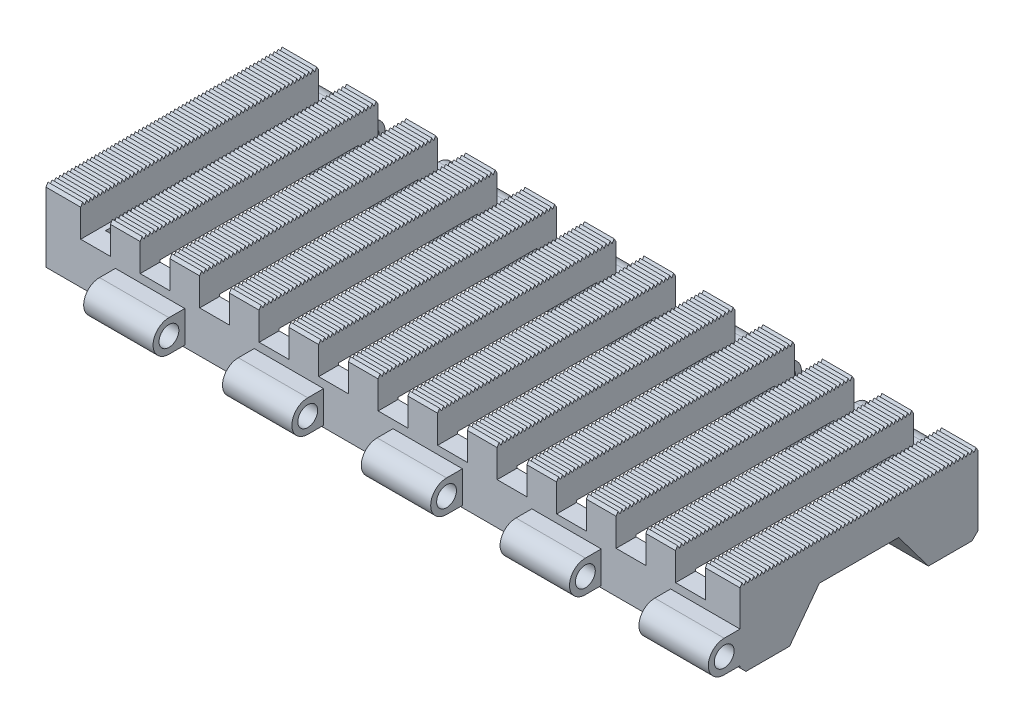
from build123d import *

# Parameters (mm, degrees)
BOSS_EXTRUDE1_DEPTH = 350
SKETCH1_3_OUTSIDE_W = 230.73
SKETCH1_3_OUTSIDE_H = 118.437
SKETCH1_3_OUTSIDE_R = 5
CUT_EXTRUDE2_DEPTH  = 350
SKETCH13_W          = 310
SKETCH13_H          = 100
CUT_EXTRUDE4_DEPTH  = 25
SKETCH13_4_W        = 35
SKETCH13_4_H        = 18.712598952
CUT_EXTRUDE12_DEPTH = 381.542793702
SKETCH15_W          = 15
SKETCH15_H          = 20
SKETCH15_H_2        = 19.813107859
SKETCH15_H_3        = 20.139700209
SKETCH15_H_4        = 23.911545417
SKETCH15_H_5        = 27.777556508
SKETCH15_H_6        = 25.56081457
SKETCH15_H_7        = 23.377606617
SKETCH15_H_8        = 22.603617706
SKETCH15_H_9        = 19.609158068
CUT_EXTRUDE18_DEPTH = 377.515335494


with BuildPart() as part:
    # Sketch1 → Boss-Extrude1 (new body)
    with BuildSketch(Plane(origin=(0, 0, 0), x_dir=(0, 0, -1), z_dir=(1, 0, 0))):
        with BuildLine():
            Line((68, 8), (48, 8))
            Line((48, 8), (33, -12))
            Line((33, -12), (11, -12))
            Line((11, -12), (8, -9))
            Line((8, -9), (8, -8.002466831))
            Line((8, -8.002466831), (0, -8.002466831))
            ThreePointArc((0, -8.002466831), (-8.002466831, 0), (0, 8.002466831))
            Line((0, 8.002466831), (8, 8.002466831))
            Line((8, 8.002466831), (8, 26.002466831))
            Line((8, 26.002466831), (9, 27.709165671))
            Line((9, 27.709165671), (10, 26.002466831))
            Line((10, 26.002466831), (11, 27.709165671))
            Line((11, 27.709165671), (12, 26.002466831))
            Line((12, 26.002466831), (13, 27.709165671))
            Line((13, 27.709165671), (14, 26.002466831))
            Line((14, 26.002466831), (15, 27.709165671))
            Line((15, 27.709165671), (16, 26.002466831))
            Line((16, 26.002466831), (17, 27.709165671))
            Line((17, 27.709165671), (18, 26.002466831))
            Line((18, 26.002466831), (19, 27.709165671))
            Line((19, 27.709165671), (20, 26.002466831))
            Line((20, 26.002466831), (21, 27.709165671))
            Line((21, 27.709165671), (22, 26.002466831))
            Line((22, 26.002466831), (23, 27.709165671))
            Line((23, 27.709165671), (24, 26.002466831))
            Line((24, 26.002466831), (25, 27.709165671))
            Line((25, 27.709165671), (26, 26.002466831))
            Line((26, 26.002466831), (27, 27.709165671))
            Line((27, 27.709165671), (28, 26.002466831))
            Line((28, 26.002466831), (29, 27.709165671))
            Line((29, 27.709165671), (30, 26.002466831))
            Line((30, 26.002466831), (31, 27.709165671))
            Line((31, 27.709165671), (32, 26.002466831))
            Line((32, 26.002466831), (33, 27.709165671))
            Line((33, 27.709165671), (34, 26.002466831))
            Line((34, 26.002466831), (35, 27.709165671))
            Line((35, 27.709165671), (36, 26.002466831))
            Line((36, 26.002466831), (37, 27.709165671))
            Line((37, 27.709165671), (38, 26.002466831))
            Line((38, 26.002466831), (39, 27.709165671))
            Line((39, 27.709165671), (40, 26.002466831))
            Line((40, 26.002466831), (41, 27.709165671))
            Line((41, 27.709165671), (42, 26.002466831))
            Line((42, 26.002466831), (43, 27.709165671))
            Line((43, 27.709165671), (44, 26.002466831))
            Line((44, 26.002466831), (45, 27.709165671))
            Line((45, 27.709165671), (46, 26.002466831))
            Line((46, 26.002466831), (47, 27.709165671))
            Line((47, 27.709165671), (48, 26.002466831))
            Line((48, 26.002466831), (49, 27.709165671))
            Line((49, 27.709165671), (50, 26.002466831))
            Line((50, 26.002466831), (51, 27.709165671))
            Line((51, 27.709165671), (52, 26.002466831))
            Line((52, 26.002466831), (53, 27.709165671))
            Line((53, 27.709165671), (54, 26.002466831))
            Line((54, 26.002466831), (55, 27.709165671))
            Line((55, 27.709165671), (56, 26.002466831))
            Line((56, 26.002466831), (57, 27.709165671))
            Line((57, 27.709165671), (58, 26.002466831))
            Line((58, 26.002466831), (59, 27.709165671))
            Line((59, 27.709165671), (60, 26.002466831))
            Line((60, 26.002466831), (61, 27.709165671))
            Line((61, 27.709165671), (62, 26.002466831))
            Line((62, 26.002466831), (63, 27.709165671))
            Line((63, 27.709165671), (64, 26.002466831))
            Line((64, 26.002466831), (65, 27.709165671))
            Line((65, 27.709165671), (66, 26.002466831))
            Line((66, 26.002466831), (67, 27.709165671))
            Line((67, 27.709165671), (68, 26.002466831))
            Line((68, 26.002466831), (69, 27.709165671))
            Line((69, 27.709165671), (70, 26.002466831))
            Line((70, 26.002466831), (71, 27.709165671))
            Line((71, 27.709165671), (72, 26.002466831))
            Line((72, 26.002466831), (73, 27.709165671))
            Line((73, 27.709165671), (74, 26.002466831))
            Line((74, 26.002466831), (75, 27.709165671))
            Line((75, 27.709165671), (76, 26.002466831))
            Line((76, 26.002466831), (77, 27.709165671))
            Line((77, 27.709165671), (78, 26.002466831))
            Line((78, 26.002466831), (79, 27.709165671))
            Line((79, 27.709165671), (80, 26.002466831))
            Line((80, 26.002466831), (81, 27.709165671))
            Line((81, 27.709165671), (82, 26.002466831))
            Line((82, 26.002466831), (83, 27.709165671))
            Line((83, 27.709165671), (84, 26.002466831))
            Line((84, 26.002466831), (85, 27.709165671))
            Line((85, 27.709165671), (86, 26.002466831))
            Line((86, 26.002466831), (87, 27.709165671))
            Line((87, 27.709165671), (88, 26.002466831))
            Line((88, 26.002466831), (89, 27.709165671))
            Line((89, 27.709165671), (90, 26.002466831))
            Line((90, 26.002466831), (91, 27.709165671))
            Line((91, 27.709165671), (92, 26.002466831))
            Line((92, 26.002466831), (93, 27.709165671))
            Line((93, 27.709165671), (94, 26.002466831))
            Line((94, 26.002466831), (95, 27.709165671))
            Line((95, 27.709165671), (96, 26.002466831))
            Line((96, 26.002466831), (97, 27.709165671))
            Line((97, 27.709165671), (98, 26.002466831))
            Line((98, 26.002466831), (99, 27.709165671))
            Line((99, 27.709165671), (100, 26.002466831))
            Line((100, 26.002466831), (101, 27.709165671))
            Line((101, 27.709165671), (102, 26.002466831))
            Line((102, 26.002466831), (103, 27.709165671))
            Line((103, 27.709165671), (104, 26.002466831))
            Line((104, 26.002466831), (105, 27.709165671))
            Line((105, 27.709165671), (106, 26.002466831))
            Line((106, 26.002466831), (107, 27.709165671))
            Line((107, 27.709165671), (108, 26.002466831))
            Line((108, 26.002466831), (109, 27.709165671))
            Line((109, 27.709165671), (110, 26.002466831))
            Line((110, 26.002466831), (111, 27.709165671))
            Line((111, 27.709165671), (112, 26.002466831))
            Line((112, 26.002466831), (113, 27.709165671))
            Line((113, 27.709165671), (114, 26.002466831))
            Line((114, 26.002466831), (115, 27.709165671))
            Line((115, 27.709165671), (116, 26.002466831))
            Line((116, 26.002466831), (117, 27.709165671))
            Line((117, 27.709165671), (118, 26.002466831))
            Line((118, 26.002466831), (119, 27.709165671))
            Line((119, 27.709165671), (120, 26.002466831))
            Line((120, 26.002466831), (121, 27.709165671))
            Line((121, 27.709165671), (122, 26.002466831))
            Line((122, 26.002466831), (123, 27.709165671))
            Line((123, 27.709165671), (124, 26.002466831))
            Line((124, 26.002466831), (125, 27.709165671))
            Line((125, 27.709165671), (126, 26.002466831))
            Line((126, 26.002466831), (127, 27.709165671))
            Line((127, 27.709165671), (128, 26.002466831))
            Line((128, 26.002466831), (128, 8))
            Line((128, 8), (136, 8))
            ThreePointArc((136, 8), (144, 0), (136, -8))
            Line((136, -8), (128, -8))
            Line((128, -8), (128, -9))
            Line((128, -9), (125, -12))
            Line((125, -12), (103, -12))
            Line((103, -12), (88, 8))
            Line((88, 8), (68, 8))
        make_face()
    extrude(amount=BOSS_EXTRUDE1_DEPTH)

    # Sketch1<3> outside → Cut-Extrude2 (cut)
    # profile 1 of 3: a face of its own
    with BuildSketch(Plane(origin=(0, 0, 0), x_dir=(0, 0, -1), z_dir=(1, 0, 0))):
        with Locations((67.999, 7.8545)):
            Rectangle(SKETCH1_3_OUTSIDE_W, SKETCH1_3_OUTSIDE_H)
        with BuildLine():
            Line((68, 8), (48, 8))
            Line((48, 8), (33, -12))
            Line((33, -12), (11, -12))
            Line((11, -12), (8, -9))
            Line((8, -9), (8, -8.002466831))
            Line((8, -8.002466831), (0, -8.002466831))
            ThreePointArc((0, -8.002466831), (-8.002466831, 0), (0, 8.002466831))
            Line((0, 8.002466831), (8, 8.002466831))
            Line((8, 8.002466831), (8, 26.002466831))
            Line((8, 26.002466831), (9, 27.709165671))
            Line((9, 27.709165671), (10, 26.002466831))
            Line((10, 26.002466831), (11, 27.709165671))
            Line((11, 27.709165671), (12, 26.002466831))
            Line((12, 26.002466831), (13, 27.709165671))
            Line((13, 27.709165671), (14, 26.002466831))
            Line((14, 26.002466831), (15, 27.709165671))
            Line((15, 27.709165671), (16, 26.002466831))
            Line((16, 26.002466831), (17, 27.709165671))
            Line((17, 27.709165671), (18, 26.002466831))
            Line((18, 26.002466831), (19, 27.709165671))
            Line((19, 27.709165671), (20, 26.002466831))
            Line((20, 26.002466831), (21, 27.709165671))
            Line((21, 27.709165671), (22, 26.002466831))
            Line((22, 26.002466831), (23, 27.709165671))
            Line((23, 27.709165671), (24, 26.002466831))
            Line((24, 26.002466831), (25, 27.709165671))
            Line((25, 27.709165671), (26, 26.002466831))
            Line((26, 26.002466831), (27, 27.709165671))
            Line((27, 27.709165671), (28, 26.002466831))
            Line((28, 26.002466831), (29, 27.709165671))
            Line((29, 27.709165671), (30, 26.002466831))
            Line((30, 26.002466831), (31, 27.709165671))
            Line((31, 27.709165671), (32, 26.002466831))
            Line((32, 26.002466831), (33, 27.709165671))
            Line((33, 27.709165671), (34, 26.002466831))
            Line((34, 26.002466831), (35, 27.709165671))
            Line((35, 27.709165671), (36, 26.002466831))
            Line((36, 26.002466831), (37, 27.709165671))
            Line((37, 27.709165671), (38, 26.002466831))
            Line((38, 26.002466831), (39, 27.709165671))
            Line((39, 27.709165671), (40, 26.002466831))
            Line((40, 26.002466831), (41, 27.709165671))
            Line((41, 27.709165671), (42, 26.002466831))
            Line((42, 26.002466831), (43, 27.709165671))
            Line((43, 27.709165671), (44, 26.002466831))
            Line((44, 26.002466831), (45, 27.709165671))
            Line((45, 27.709165671), (46, 26.002466831))
            Line((46, 26.002466831), (47, 27.709165671))
            Line((47, 27.709165671), (48, 26.002466831))
            Line((48, 26.002466831), (49, 27.709165671))
            Line((49, 27.709165671), (50, 26.002466831))
            Line((50, 26.002466831), (51, 27.709165671))
            Line((51, 27.709165671), (52, 26.002466831))
            Line((52, 26.002466831), (53, 27.709165671))
            Line((53, 27.709165671), (54, 26.002466831))
            Line((54, 26.002466831), (55, 27.709165671))
            Line((55, 27.709165671), (56, 26.002466831))
            Line((56, 26.002466831), (57, 27.709165671))
            Line((57, 27.709165671), (58, 26.002466831))
            Line((58, 26.002466831), (59, 27.709165671))
            Line((59, 27.709165671), (60, 26.002466831))
            Line((60, 26.002466831), (61, 27.709165671))
            Line((61, 27.709165671), (62, 26.002466831))
            Line((62, 26.002466831), (63, 27.709165671))
            Line((63, 27.709165671), (64, 26.002466831))
            Line((64, 26.002466831), (65, 27.709165671))
            Line((65, 27.709165671), (66, 26.002466831))
            Line((66, 26.002466831), (67, 27.709165671))
            Line((67, 27.709165671), (68, 26.002466831))
            Line((68, 26.002466831), (69, 27.709165671))
            Line((69, 27.709165671), (70, 26.002466831))
            Line((70, 26.002466831), (71, 27.709165671))
            Line((71, 27.709165671), (72, 26.002466831))
            Line((72, 26.002466831), (73, 27.709165671))
            Line((73, 27.709165671), (74, 26.002466831))
            Line((74, 26.002466831), (75, 27.709165671))
            Line((75, 27.709165671), (76, 26.002466831))
            Line((76, 26.002466831), (77, 27.709165671))
            Line((77, 27.709165671), (78, 26.002466831))
            Line((78, 26.002466831), (79, 27.709165671))
            Line((79, 27.709165671), (80, 26.002466831))
            Line((80, 26.002466831), (81, 27.709165671))
            Line((81, 27.709165671), (82, 26.002466831))
            Line((82, 26.002466831), (83, 27.709165671))
            Line((83, 27.709165671), (84, 26.002466831))
            Line((84, 26.002466831), (85, 27.709165671))
            Line((85, 27.709165671), (86, 26.002466831))
            Line((86, 26.002466831), (87, 27.709165671))
            Line((87, 27.709165671), (88, 26.002466831))
            Line((88, 26.002466831), (89, 27.709165671))
            Line((89, 27.709165671), (90, 26.002466831))
            Line((90, 26.002466831), (91, 27.709165671))
            Line((91, 27.709165671), (92, 26.002466831))
            Line((92, 26.002466831), (93, 27.709165671))
            Line((93, 27.709165671), (94, 26.002466831))
            Line((94, 26.002466831), (95, 27.709165671))
            Line((95, 27.709165671), (96, 26.002466831))
            Line((96, 26.002466831), (97, 27.709165671))
            Line((97, 27.709165671), (98, 26.002466831))
            Line((98, 26.002466831), (99, 27.709165671))
            Line((99, 27.709165671), (100, 26.002466831))
            Line((100, 26.002466831), (101, 27.709165671))
            Line((101, 27.709165671), (102, 26.002466831))
            Line((102, 26.002466831), (103, 27.709165671))
            Line((103, 27.709165671), (104, 26.002466831))
            Line((104, 26.002466831), (105, 27.709165671))
            Line((105, 27.709165671), (106, 26.002466831))
            Line((106, 26.002466831), (107, 27.709165671))
            Line((107, 27.709165671), (108, 26.002466831))
            Line((108, 26.002466831), (109, 27.709165671))
            Line((109, 27.709165671), (110, 26.002466831))
            Line((110, 26.002466831), (111, 27.709165671))
            Line((111, 27.709165671), (112, 26.002466831))
            Line((112, 26.002466831), (113, 27.709165671))
            Line((113, 27.709165671), (114, 26.002466831))
            Line((114, 26.002466831), (115, 27.709165671))
            Line((115, 27.709165671), (116, 26.002466831))
            Line((116, 26.002466831), (117, 27.709165671))
            Line((117, 27.709165671), (118, 26.002466831))
            Line((118, 26.002466831), (119, 27.709165671))
            Line((119, 27.709165671), (120, 26.002466831))
            Line((120, 26.002466831), (121, 27.709165671))
            Line((121, 27.709165671), (122, 26.002466831))
            Line((122, 26.002466831), (123, 27.709165671))
            Line((123, 27.709165671), (124, 26.002466831))
            Line((124, 26.002466831), (125, 27.709165671))
            Line((125, 27.709165671), (126, 26.002466831))
            Line((126, 26.002466831), (127, 27.709165671))
            Line((127, 27.709165671), (128, 26.002466831))
            Line((128, 26.002466831), (128, 8))
            Line((128, 8), (136, 8))
            ThreePointArc((136, 8), (144, 0), (136, -8))
            Line((136, -8), (128, -8))
            Line((128, -8), (128, -9))
            Line((128, -9), (125, -12))
            Line((125, -12), (103, -12))
            Line((103, -12), (88, 8))
            Line((88, 8), (68, 8))
        make_face(mode=Mode.SUBTRACT)
    # profile 2 of 3: a face of its own
    with BuildSketch(Plane(origin=(0, 0, 0), x_dir=(0, 0, -1), z_dir=(1, 0, 0))):
        Circle(SKETCH1_3_OUTSIDE_R)
    # profile 3 of 3: a face of its own
    with BuildSketch(Plane(origin=(0, 0, 0), x_dir=(0, 0, -1), z_dir=(1, 0, 0))):
        with Locations((136, 0)):
            Circle(SKETCH1_3_OUTSIDE_R)
    extrude(amount=CUT_EXTRUDE2_DEPTH, mode=Mode.SUBTRACT)

    # Sketch13 → Cut-Extrude4 (cut)
    with BuildSketch(Plane.XZ.offset(12)):
        with Locations((175, -68)):
            Rectangle(SKETCH13_W, SKETCH13_H)
    extrude(amount=-CUT_EXTRUDE4_DEPTH, mode=Mode.SUBTRACT)

    # Sketch13<4> → Cut-Extrude12 (cut, through all)
    with BuildSketch(Plane.XZ.offset(12)):
        with Locations((17.5, 1.356299476)):
            Rectangle(SKETCH13_4_W, SKETCH13_4_H)
        with Locations((52.5, -137.356299476)):
            Rectangle(SKETCH13_4_W, SKETCH13_4_H)
        with Locations((87.5, 1.356299476)):
            Rectangle(SKETCH13_4_W, SKETCH13_4_H)
        with Locations((122.5, -137.356299476)):
            Rectangle(SKETCH13_4_W, SKETCH13_4_H)
        with Locations((157.5, 1.356299476)):
            Rectangle(SKETCH13_4_W, SKETCH13_4_H)
        with Locations((192.5, -137.356299476)):
            Rectangle(SKETCH13_4_W, SKETCH13_4_H)
        with Locations((227.5, 1.356299476)):
            Rectangle(SKETCH13_4_W, SKETCH13_4_H)
        with Locations((262.5, -137.356299476)):
            Rectangle(SKETCH13_4_W, SKETCH13_4_H)
        with Locations((297.5, 1.356299476)):
            Rectangle(SKETCH13_4_W, SKETCH13_4_H)
        with Locations((332.5, -137.356299476)):
            Rectangle(SKETCH13_4_W, SKETCH13_4_H)
    extrude(amount=-CUT_EXTRUDE12_DEPTH, mode=Mode.SUBTRACT)

    # Sketch15 → Cut-Extrude18 (cut, through all)
    with BuildSketch(Plane.XY.offset(-8)):
        with Locations((25, 22)):
            Rectangle(SKETCH15_W, SKETCH15_H)
        with Locations((55, 22)):
            Rectangle(SKETCH15_W, SKETCH15_H)
        with Locations((85, 22)):
            Rectangle(SKETCH15_W, SKETCH15_H)
        with Locations((115, 21.906553929)):
            Rectangle(SKETCH15_W, SKETCH15_H_2)
        with Locations((145, 22.069850105)):
            Rectangle(SKETCH15_W, SKETCH15_H_3)
        with Locations((175, 23.955772708)):
            Rectangle(SKETCH15_W, SKETCH15_H_4)
        with Locations((205, 25.888778254)):
            Rectangle(SKETCH15_W, SKETCH15_H_5)
        with Locations((235, 24.780407285)):
            Rectangle(SKETCH15_W, SKETCH15_H_6)
        with Locations((265, 23.688803309)):
            Rectangle(SKETCH15_W, SKETCH15_H_7)
        with Locations((295, 23.301808853)):
            Rectangle(SKETCH15_W, SKETCH15_H_8)
        with Locations((325, 21.804579034)):
            Rectangle(SKETCH15_W, SKETCH15_H_9)
    extrude(amount=-CUT_EXTRUDE18_DEPTH, mode=Mode.SUBTRACT)


solid = part.part
